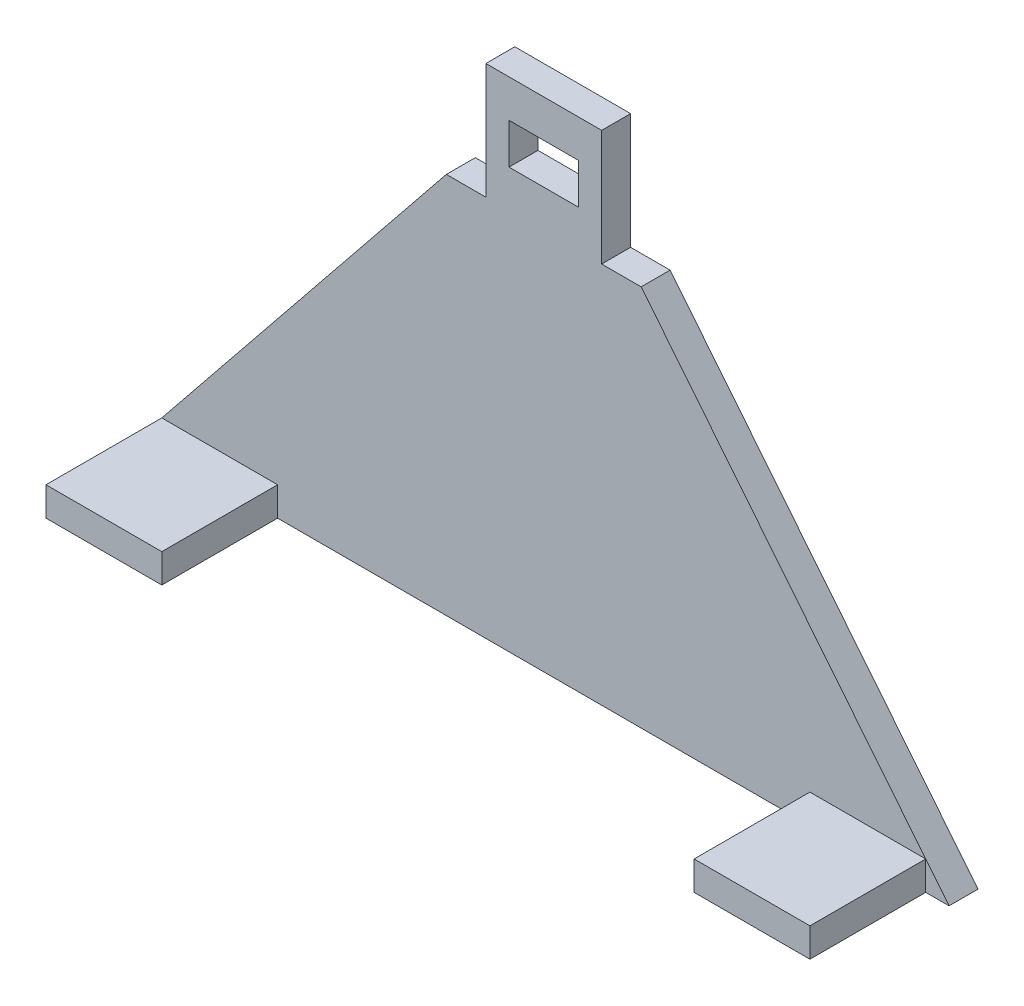
from build123d import *

# Parameters (mm, degrees)
BASE_FLANGE1_DEPTH  = 2.5
SKETCH6_W           = 6
SKETCH6_H           = 3.5
CUT_EXTRUDE1_DEPTH  = 10
SKETCH7_W           = 10
SKETCH7_H           = 2.5
BOSS_EXTRUDE1_DEPTH = 10


# Sheet-metal steps are written as plain solids
with BuildPart() as part:
    # Sketch1 → Base-Flange1 (new body)
    with BuildSketch(Plane.XY):
        Polygon((-35, 0), (35, 0), (8.412017167, 33), (5, 33), (5, 43), (-5, 43), (-5, 33), (-8.412017167, 33), align=None)
    extrude(amount=-BASE_FLANGE1_DEPTH)

    # Sketch6 → Cut-Extrude1 (cut)
    with BuildSketch(Plane.XY):
        with Locations((0, 38)):
            Rectangle(SKETCH6_W, SKETCH6_H)
    extrude(amount=-CUT_EXTRUDE1_DEPTH, mode=Mode.SUBTRACT)

    # Sketch7 → Boss-Extrude1 (add)
    with BuildSketch(Plane.XY):
        with Locations((-27.985758876, 1.25)):
            Rectangle(SKETCH7_W, SKETCH7_H)
    boss_extrude1 = extrude(amount=BOSS_EXTRUDE1_DEPTH)

    # Mirror1: Boss-Extrude1 across plane
    add(boss_extrude1.mirror(Plane(origin=(0, 0, 0), x_dir=(0, 0, 1), z_dir=(1, 0, 0))))


solid = part.part
